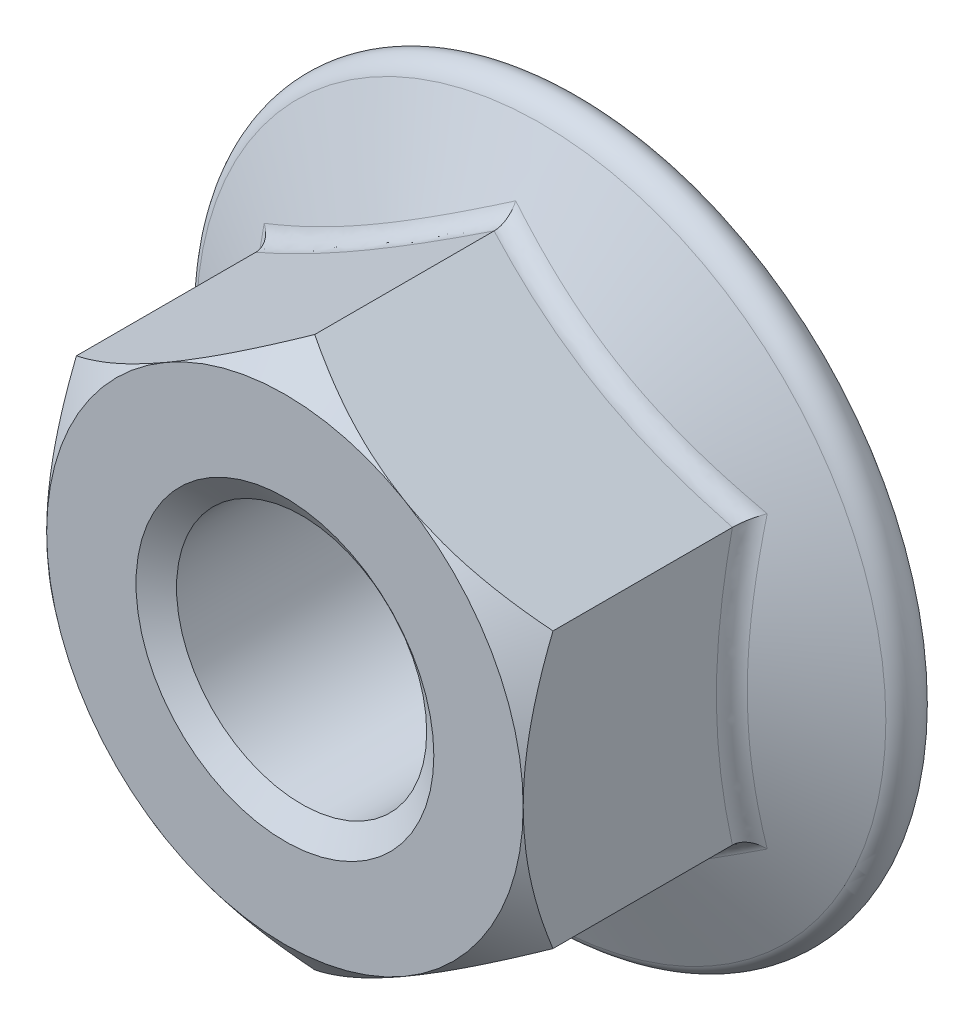
from build123d import *

# Parameters (mm, degrees)
BASENUT_START  = -5
BASENUTSKE_R   = 2.1
BASENUT_DEPTH  = 5
FLANGEFILLET_R = 0.35


# Read off the part's stored shape, not the designer's step: ThreadSchematic
with BuildPart() as part:
    # BaseNutSke → BaseNut (new body)
    with BuildSketch(Plane.XY.offset(BASENUT_START)):
        Polygon((4, 2.309401077), (4, -2.309401077), (0, -4.618802154), (-4, -2.309401077), (-4, 2.309401077), (0, 4.618802154), align=None)
        Circle(BASENUTSKE_R, mode=Mode.SUBTRACT)
    extrude(amount=BASENUT_DEPTH)

    # Sketch5 (on Right Plane) → EndChamfer (revolve, cut)
    with BuildSketch(Plane(origin=(0, 0, 0), x_dir=(0, 0, -1), z_dir=(1, 0, 0))):
        Polygon((4.9746, 2.5), (4.666508683, 2.06), (5.0254, 2.06), (5.0254, 2.5), align=None)
    revolve(axis=Axis((0, 2.06, -5.0254), (0, 0, 1)), mode=Mode.SUBTRACT)

    # Sketch6 → Flange (revolve)
    with BuildSketch(Plane(origin=(0, 0, 0), x_dir=(0, 0, -1), z_dir=(1, 0, 0)), mode=Mode.PRIVATE) as flange_sk:
        with BuildLine():
            Line((2.580264687, 2.1), (4.3, 5.787984281))
            ThreePointArc((4.3, 5.787984281), (4.712275072, 5.991295847), (5, 5.632798017))
            Line((5, 5.632798017), (5, 2.1))
            Line((5, 2.1), (2.580264687, 2.1))
        make_face()
    revolve(flange_sk.sketch.rotate(Axis((0, 0, 0), (0, 0, -1)), 90), axis=Axis((0, 0, 0), (0, 0, -1)))

    # Sketch3 → Double-Chamfer (revolve, cut)
    with BuildSketch(Plane(origin=(0, 0, 0), x_dir=(0, 0, -1), z_dir=(1, 0, 0)), mode=Mode.PRIVATE) as double_chamfer_sk:
        Polygon((0.5, 17.318802154), (-12.7, 17.318802154), (-12.7, 4), (0, 4), (0.5, 4.618802154), align=None)
    revolve(double_chamfer_sk.sketch.rotate(Axis((0, 0, 0), (0, 0, -1)), 90), axis=Axis((0, 0, 0), (0, 0, -1)), mode=Mode.SUBTRACT)

    # FlangeFillet
    flangefillet_edges = [part.edges().sort_by_distance(p)[0] for p in [
        (4, 1.162907351, -3.54347707),
        (2, 3.464101615, -3.466249237),
        (-2, 3.464101615, -3.466249237),
        (-4, 0, -3.466249237),
        (-2, -3.464101615, -3.466249237),
        (2, -3.464101615, -3.466249237),
        (4, -1.162907351, -3.54347707),
    ]]
    fillet(flangefillet_edges, radius=FLANGEFILLET_R)

    # ThreadSchematic outline → ThreadSchematic (revolve, cut)
    with BuildSketch(Plane.XZ):
        Polygon((2.1, 0), (2.1, -0.280083015), (2.5, 0), align=None)
        Polygon((2.5, -4.9746), (2.1, -4.694516985), (2.1, -5), (2.5, -5), align=None)
    revolve(axis=Axis((0, 0, 0), (0, 0, 1)), mode=Mode.SUBTRACT)


solid = part.part
